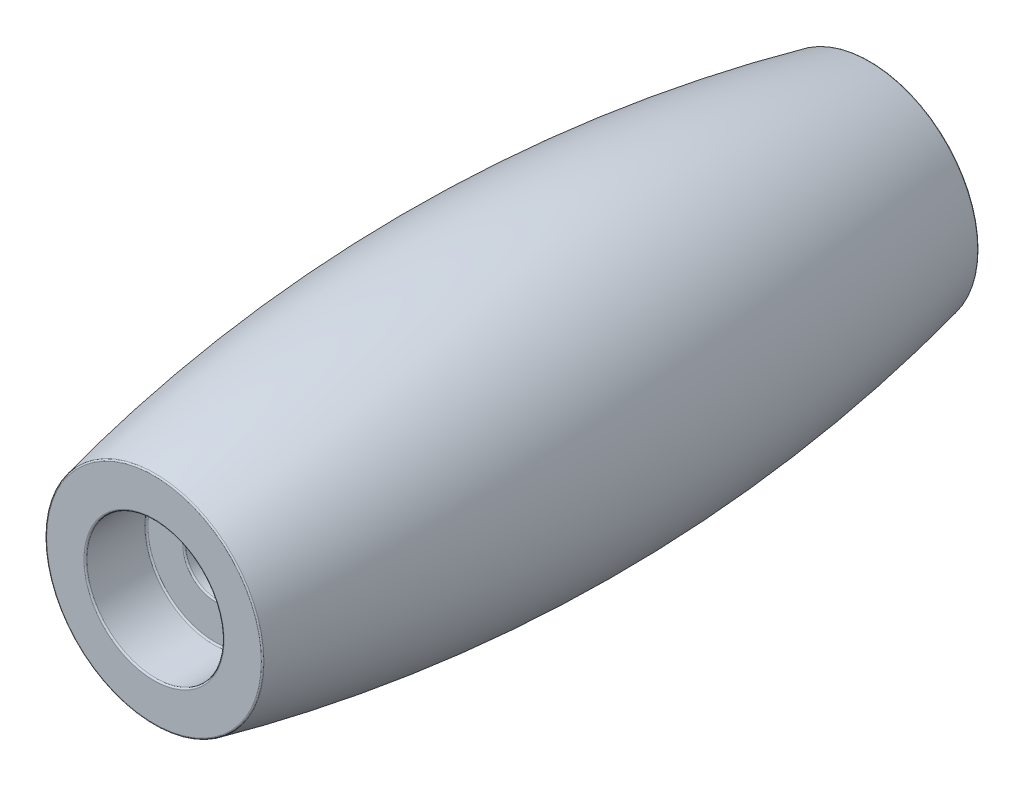
from build123d import *

# Parameters (mm, degrees)
FILLET1_R = 0.1


with BuildPart() as part:
    # Sketch1 → Revolve1 (revolve)
    with BuildSketch(Plane(origin=(0, 0, 0), x_dir=(1, 0, 0), z_dir=(0, 1, 0))):
        with BuildLine():
            Line((2, 19.5), (2, -19.5))
            Line((2, -19.5), (4.5, -19.5))
            Line((4.5, -19.5), (4.5, -23.5))
            Line((4.5, -23.5), (7.125, -23.5))
            ThreePointArc((7.125, -23.5), (9.725, 0), (7.125, 23.5))
            Line((7.125, 23.5), (4.5, 23.5))
            Line((4.5, 23.5), (4.5, 19.5))
            Line((4.5, 19.5), (2, 19.5))
        make_face()
    revolve(axis=Axis((0, 0, -23.5), (0, 0, 1)))

    # Fillet1
    fillet1_edges = [part.edges().sort_by_distance(p)[0] for p in [
        (-2, 0, -19.5),
        (-4.5, 0, -19.5),
        (-4.5, 0, -23.5),
        (-7.125, 0, -23.5),
        (-2, 0, 19.5),
        (-4.5, 0, 19.5),
        (-4.5, 0, 23.5),
        (-7.125, 0, 23.5),
    ]]
    fillet(fillet1_edges, radius=FILLET1_R)


solid = part.part
